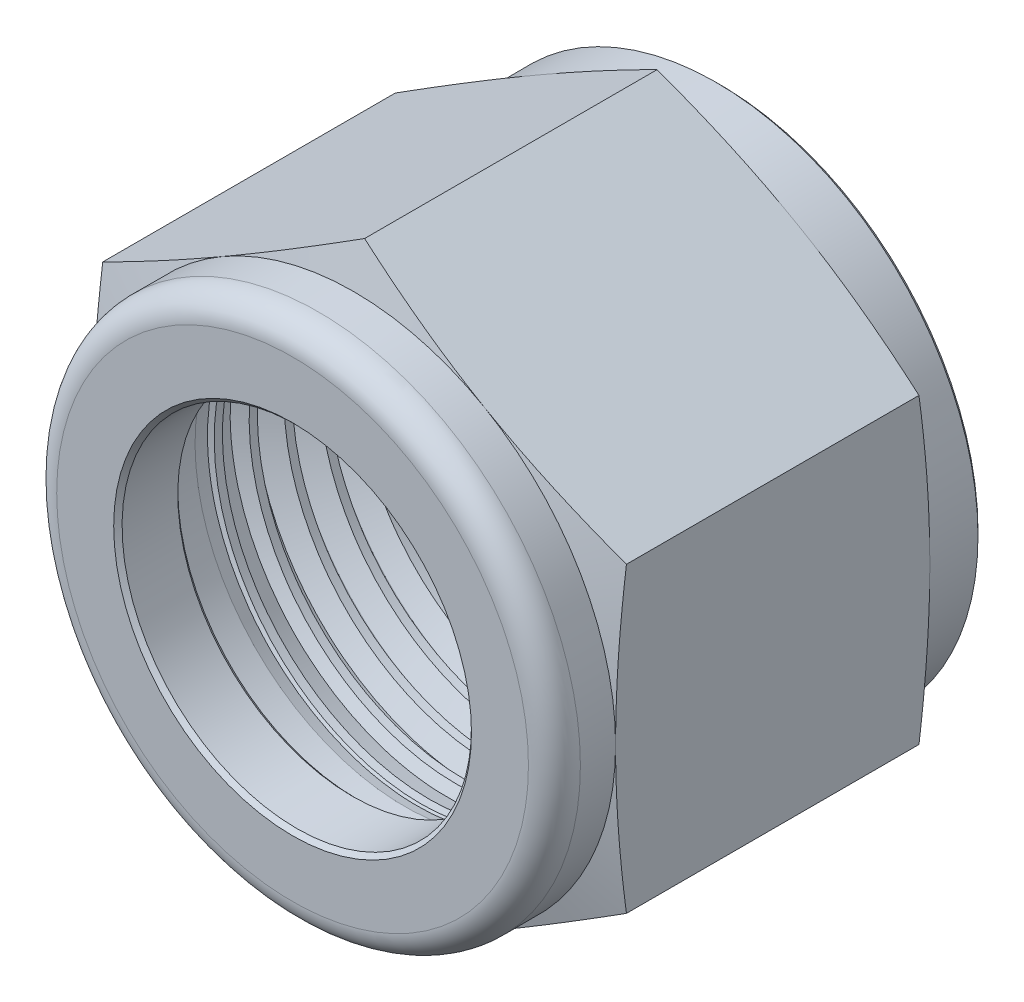
from build123d import *
from build123d.topology import SkipClean

# Parameters (mm, degrees)
BOSS_EXTRUDE1_DEPTH = 25.9334
FILLET1_R           = 1.5748
CHAMFER1_SIZE       = 0.254
CHAMFER2_SIZE       = 0.254
CUT_SWEEP1_PITCH    = 2.116666667


with BuildPart() as part:
    # Sketch1 → Boss-Extrude1 (new body)
    with BuildSketch(Plane.XY):
        Polygon((0, 18.330871047), (-15.875, 9.165435523), (-15.875, -9.165435523), (0, -18.330871047), (15.875, -9.165435523), (15.875, 9.165435523), align=None)
    extrude(amount=BOSS_EXTRUDE1_DEPTH)

    # Sketch2 → Cut-Revolve1 (revolve, cut)
    with BuildSketch(Plane(origin=(0, 0, 0), x_dir=(0, 0, -1), z_dir=(1, 0, 0))):
        Polygon((-25.9334, 20.786742094), (-25.9334, 15.875), (-22.225, 15.875), (-21.566951336, 18.330871047), (-3.833048664, 18.330871047), (-3.175, 15.875), (0, 15.875), (0, 20.786742094), align=None)
        with BuildLine():
            Line((-25.9334, 10.5918), (-25.9334, 0))
            Line((-25.9334, 0), (0, 0))
            Line((0, 0), (0, 12.720416378))
            Line((0, 12.720416378), (-21.7932, 12.720416378))
            ThreePointArc((-21.7932, 12.720416378), (-21.972805122, 12.6460215), (-22.0472, 12.466416378))
            Line((-22.0472, 12.466416378), (-22.0472, 10.5918))
            Line((-22.0472, 10.5918), (-25.9334, 10.5918))
        make_face()
    revolve(axis=Axis((0, 0, 0), (0, 0, 1)), mode=Mode.SUBTRACT)

    # Fillet1
    fillet1_edges = [part.edges().sort_by_distance(p)[0] for p in [
        (0, -15.875, 25.9334),
    ]]
    fillet(fillet1_edges, radius=FILLET1_R)

    # Chamfer1
    chamfer1_edges = [part.edges().sort_by_distance(p)[0] for p in [
        (0, -15.875, 0),
    ]]
    chamfer(chamfer1_edges, length=CHAMFER1_SIZE)

    # Chamfer2
    chamfer2_edges = [part.edges().sort_by_distance(p)[0] for p in [
        (0, -10.5918, 25.9334),
        (0, -10.5918, 22.0472),
    ]]
    chamfer(chamfer2_edges, length=CHAMFER2_SIZE)

    # Cut-Sweep1: the profile of Sketch4 screwed along a right-hand helix of 10.036 turns, 10 arcs to a turn; built about Z, then put on its axis
    cut_sweep1_z = Axis((0, 0, 0), (0, 0, 1))
    cut_sweep1_corners = [(13.952021776, 0, -0.711067708), (12.505601483, 0, 0.124023437), (12.505601483, 0, -1.744596354), (13.952021776, 0, -0.909505208), (14.009305748, 0, -0.810286458)]
    with BuildLine(mode=Mode.PRIVATE) as cut_sweep1_profile:
        Line(cut_sweep1_corners[0], cut_sweep1_corners[1])
        Line(cut_sweep1_corners[1], cut_sweep1_corners[2])
        Line(cut_sweep1_corners[2], cut_sweep1_corners[3])
        ThreePointArc((13.952021776, 0, -0.909505208), (13.993956554, 0, -0.86757043), (14.009305748, 0, -0.810286458))
        ThreePointArc((14.009305748, 0, -0.810286458), (13.993956554, 0, -0.753002486), (13.952021776, 0, -0.711067708))
    cut_sweep1_cap = Face(cut_sweep1_profile.wire())
    cut_sweep1_arcs = [((13.952021776, 0, -0.909505208), (14.009305748, 0, -0.876432292), (14.009305748, 0, -0.810286458), (1, 0.8660254037844366, 1)), ((14.009305748, 0, -0.810286458), (14.009305748, 0, -0.744140625), (13.952021776, 0, -0.711067708), (1, 0.8660254037844366, 1))]  # start, shoulder, end, weights
    cut_sweep1_turn_angles = [0, 18, 36, 54, 72, 90, 108, 126, 144, 162, 180, 198, 216, 234, 252, 270, 288, 306, 324, 342, 360]
    cut_sweep1_turn_weights = [1, 0.9510565162951535, 1, 0.9510565162951535, 1, 0.9510565162951535, 1, 0.9510565162951535, 1, 0.9510565162951535, 1, 0.9510565162951535, 1, 0.9510565162951535, 1, 0.9510565162951535, 1, 0.9510565162951535, 1, 0.9510565162951535, 1]
    cut_sweep1_turn_rails = [Edge.make_bspline([Vector(p[0], p[1], 0).rotate(cut_sweep1_z, cut_sweep1_turn_angles[k]) / cut_sweep1_turn_weights[k] + Vector(0, 0, p[2] + CUT_SWEEP1_PITCH * cut_sweep1_turn_angles[k] / 360) for k in range(21)], [0, 0, 0, 1, 1, 2, 2, 3, 3, 4, 4, 5, 5, 6, 6, 7, 7, 8, 8, 9, 9, 10, 10, 10], 2, cut_sweep1_turn_weights) for p in cut_sweep1_corners]
    cut_sweep1_turn_sides = [*[Face.make_surface_from_curves(cut_sweep1_turn_rails[p[0]], cut_sweep1_turn_rails[p[1]]) for p in [(0, 1), (1, 2), (2, 3)]], *[Face.make_bezier_surface([[Vector(p[j][0], p[j][1], 0).rotate(cut_sweep1_z, cut_sweep1_turn_angles[2 * i + k]) / cut_sweep1_turn_weights[2 * i + k] + Vector(0, 0, p[j][2] + CUT_SWEEP1_PITCH * cut_sweep1_turn_angles[2 * i + k] / 360) for k in range(3)] for j in range(3)], [[p[3][j] * cut_sweep1_turn_weights[2 * i + k] for k in range(3)] for j in range(3)]) for p in cut_sweep1_arcs for i in range(10)]]
    cut_sweep1_last_angles = [3600, 3606.48, 3612.96]
    cut_sweep1_last_weights = [1, 0.9936113105199756, 1]
    cut_sweep1_last_rails = [Edge.make_bspline([Vector(p[0], p[1], 0).rotate(cut_sweep1_z, cut_sweep1_last_angles[k]) / cut_sweep1_last_weights[k] + Vector(0, 0, p[2] + CUT_SWEEP1_PITCH * cut_sweep1_last_angles[k] / 360) for k in range(3)], [0, 0, 0, 1, 1, 1], 2, cut_sweep1_last_weights) for p in cut_sweep1_corners]
    cut_sweep1_last_sides = [*[Face.make_surface_from_curves(cut_sweep1_last_rails[p[0]], cut_sweep1_last_rails[p[1]]) for p in [(0, 1), (1, 2), (2, 3)]], *[Face.make_bezier_surface([[Vector(p[j][0], p[j][1], 0).rotate(cut_sweep1_z, cut_sweep1_last_angles[2 * i + k]) / cut_sweep1_last_weights[2 * i + k] + Vector(0, 0, p[j][2] + CUT_SWEEP1_PITCH * cut_sweep1_last_angles[2 * i + k] / 360) for k in range(3)] for j in range(3)], [[p[3][j] * cut_sweep1_last_weights[2 * i + k] for k in range(3)] for j in range(3)]) for p in cut_sweep1_arcs for i in range(1)]]
    cut_sweep1 = Plane(origin=(0, 0, 0), x_dir=(0, 1, 0), z_dir=(0, 0, 1)) * Solid(Shell([*[p.moved(Location((0, 0, CUT_SWEEP1_PITCH * i))) for i in range(10) for p in cut_sweep1_turn_sides], *cut_sweep1_last_sides, cut_sweep1_cap, cut_sweep1_cap.rotate(cut_sweep1_z, 3612.96).moved(Location((0, 0, CUT_SWEEP1_PITCH * 3612.96 / 360)))]))
    add(cut_sweep1, mode=Mode.SUBTRACT)

    # Cut-Extrude1 cone 1 section (through the dimple's axis) → Cut-Extrude1 (revolve, cut)
    with BuildSketch(Plane.YZ):
        Polygon((0, 0), (13.4874, 0), (0, 13.4874), align=None)
    revolve(axis=Axis((0, 0, 0), (0, 0, 1)), mode=Mode.SUBTRACT)

    # Sketch6 → Revolve1 (revolve)
    with SkipClean():  # the faces are left unmerged after this step: merging them gives an invalid solid
        with BuildSketch(Plane(origin=(0, 0, 0), x_dir=(0, 0, -1), z_dir=(1, 0, 0))):
            Polygon((-22.0472, 14.123873692), (-13.6398, 14.123873692), (-19.1262, 12.720416378), (-22.0472, 12.720416378), align=None)
        revolve(axis=Axis((0, 0, 0), (0, 0, 1)))


solid = part.part
